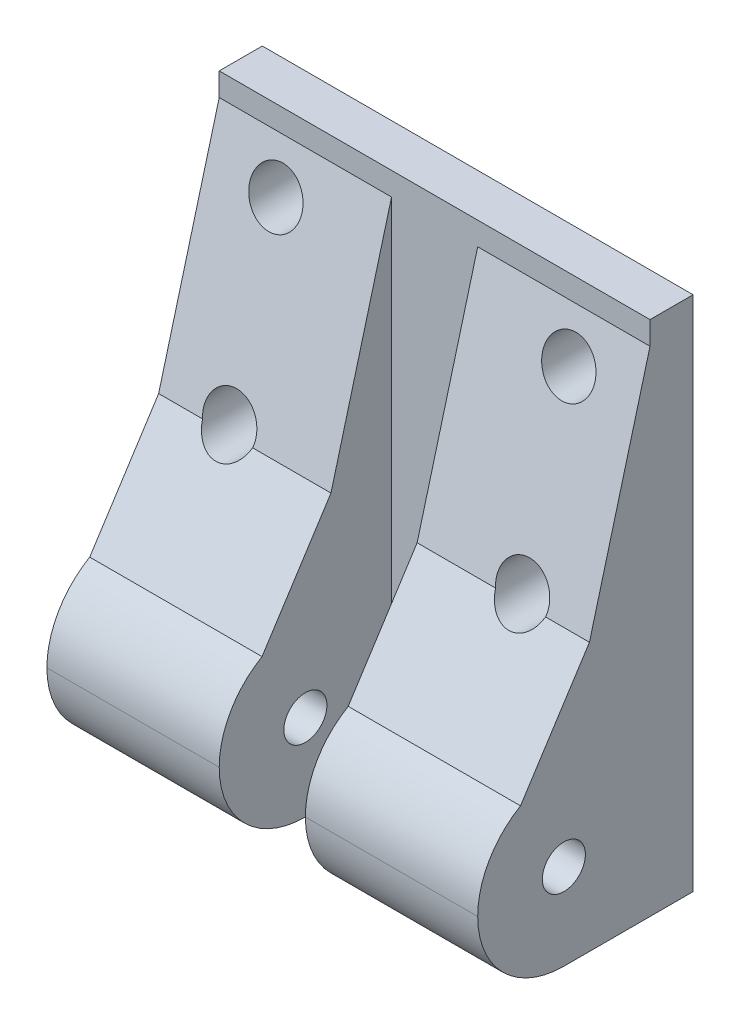
from build123d import *
from OCP.BRepFilletAPI import BRepFilletAPI_MakeChamfer

# Parameters (mm, degrees)
SZKIC1_W                    = 50
SZKIC1_H                    = 20
DODANIE_WYCI_GNI_CIE1_DEPTH = 5
SZKIC2_W                    = 20
SZKIC2_H                    = 20
DODANIE_WYCI_GNI_CIE2_DEPTH = 20
SZKIC3_R                    = 2.5
WYTNIJ_WYCI_GNI_CIE1_DEPTH  = 60.371710435
ZAOKR_GLENIE1_R             = 10
SZKIC4_W                    = 50
SZKIC4_H                    = 5
DODANIE_WYCI_GNI_CIE3_DEPTH = 40
SFAZOWANIE1_SIZE            = 10
SFAZOWANIE1_SIZE2           = 37.320508076
SFAZOWANIE2_OUTLINE_R       = 2.5
SFAZOWANIE2_DEPTH           = 20
SFAZOWANIE2_START           = 30
SFAZOWANIE2_2_OUTLINE_R     = 2.5
SFAZOWANIE2_2_DEPTH         = 20
SZKIC5_R                    = 3.043345969
WYTNIJ_WYCI_GNI_CIE2_DEPTH  = 83.006097334


with BuildPart() as part:
    # Szkic1 → Dodanie-wyciągnięcie1 (new body)
    with BuildSketch(Plane.XY):
        with Locations((25, 10)):
            Rectangle(SZKIC1_W, SZKIC1_H)
    extrude(amount=DODANIE_WYCI_GNI_CIE1_DEPTH)

    # Szkic2 → Dodanie-wyciągnięcie2 (add)
    with BuildSketch(Plane.XY.offset(5)):
        with Locations((10, 10)):
            Rectangle(SZKIC2_W, SZKIC2_H)
        with Locations((40, 10)):
            Rectangle(SZKIC2_W, SZKIC2_H)
    extrude(amount=DODANIE_WYCI_GNI_CIE2_DEPTH)

    # Szkic3 → Wytnij-wyciągnięcie1 (cut, through all)
    with BuildSketch(Plane.ZY):
        with Locations((15, 10)):
            Circle(SZKIC3_R)
    extrude(amount=-WYTNIJ_WYCI_GNI_CIE1_DEPTH, mode=Mode.SUBTRACT)

    # Zaokrąglenie1
    zaokr_glenie1_edges = [part.edges().sort_by_distance(p)[0] for p in [
        (40, 20, 25),
        (40, 0, 25),
        (10, 0, 25),
        (10, 20, 25),
    ]]
    fillet(zaokr_glenie1_edges, radius=ZAOKR_GLENIE1_R - 0.0001)  # a hair under: the kernel refuses the full size

    # Szkic4 → Dodanie-wyciągnięcie3 (add)
    with BuildSketch(Plane(origin=(0, 20, 0), x_dir=(1, 0, 0), z_dir=(0, 1, 0))):
        with Locations((25, -2.5)):
            Rectangle(SZKIC4_W, SZKIC4_H)
    extrude(amount=DODANIE_WYCI_GNI_CIE3_DEPTH)

    # Sfazowanie1: one chamfer whose edges measure the first distance from different faces: ONE call of the kernel's chamfer builder (chamfer() names one face for all edges)
    sfazowanie1_edges_1 = [part.edges().sort_by_distance(p)[0] for p in [
        (40, 20, 5),
    ]]
    sfazowanie1_side_1 = [part.faces().sort_by_distance(p)[0] for p in [
        (40, 20, 10.00005),
    ]]
    sfazowanie1_edges_2 = [part.edges().sort_by_distance(p)[0] for p in [
        (10, 20, 5),
    ]]
    sfazowanie1_side_2 = [part.faces().sort_by_distance(p)[0] for p in [
        (10, 20, 10.00005),
    ]]
    sfazowanie1 = BRepFilletAPI_MakeChamfer(part.part.solid().wrapped)
    for e in sfazowanie1_edges_1:
        sfazowanie1.Add(SFAZOWANIE1_SIZE, SFAZOWANIE1_SIZE2, e.wrapped, sfazowanie1_side_1[0].wrapped)  # the first distance lies on this face
    for e in sfazowanie1_edges_2:
        sfazowanie1.Add(SFAZOWANIE1_SIZE, SFAZOWANIE1_SIZE2, e.wrapped, sfazowanie1_side_2[0].wrapped)  # the first distance lies on this face
    add(Compound.cast(sfazowanie1.Shape()), mode=Mode.REPLACE)

    # Sfazowanie2: read off the stored shape, not the designer's step
    # Sfazowanie2 outline → Sfazowanie2 (add)
    with BuildSketch(Plane.YZ):
        with BuildLine():
            Line((0, 15), (0, 0))
            Line((0, 0), (60, 0))
            Line((60, 0), (60, 5))
            Line((60, 5), (57.320508076, 5))
            Line((57.320508076, 5), (31.081570656, 12.030702092))
            Line((31.081570656, 12.030702092), (18.642014143, 20.031460181))
            ThreePointArc((18.642014143, 20.031460181), (7.394250725, 24.654536276), (0, 15))
        make_face()
        with Locations((10, 15)):
            Circle(SFAZOWANIE2_OUTLINE_R, mode=Mode.SUBTRACT)
    extrude(amount=SFAZOWANIE2_DEPTH)

    # Sfazowanie2 2 outline → Sfazowanie2 2 (add)
    with BuildSketch(Plane.YZ.offset(SFAZOWANIE2_START)):
        with BuildLine():
            Line((0, 15), (0, 0))
            Line((0, 0), (60, 0))
            Line((60, 0), (60, 5))
            Line((60, 5), (57.320508076, 5))
            Line((57.320508076, 5), (31.081570656, 12.030702092))
            Line((31.081570656, 12.030702092), (18.642014143, 20.031460181))
            ThreePointArc((18.642014143, 20.031460181), (7.394250725, 24.654536276), (0, 15))
        make_face()
        with Locations((10, 15)):
            Circle(SFAZOWANIE2_2_OUTLINE_R, mode=Mode.SUBTRACT)
    extrude(amount=SFAZOWANIE2_2_DEPTH)

    # Szkic5 → Wytnij-wyciągnięcie2 (cut, through all)
    with BuildSketch(Plane(origin=(0, 0, 0), x_dir=(-1, 0, 0), z_dir=(0, 0, -1))):
        with Locations((-42, 52)):
            Circle(SZKIC5_R)
        with Locations((-8, 52)):
            Circle(SZKIC5_R)
        with Locations((-8, 32)):
            Circle(SZKIC5_R)
        with Locations((-42, 32)):
            Circle(SZKIC5_R)
    extrude(amount=-WYTNIJ_WYCI_GNI_CIE2_DEPTH, mode=Mode.SUBTRACT)


solid = part.part
